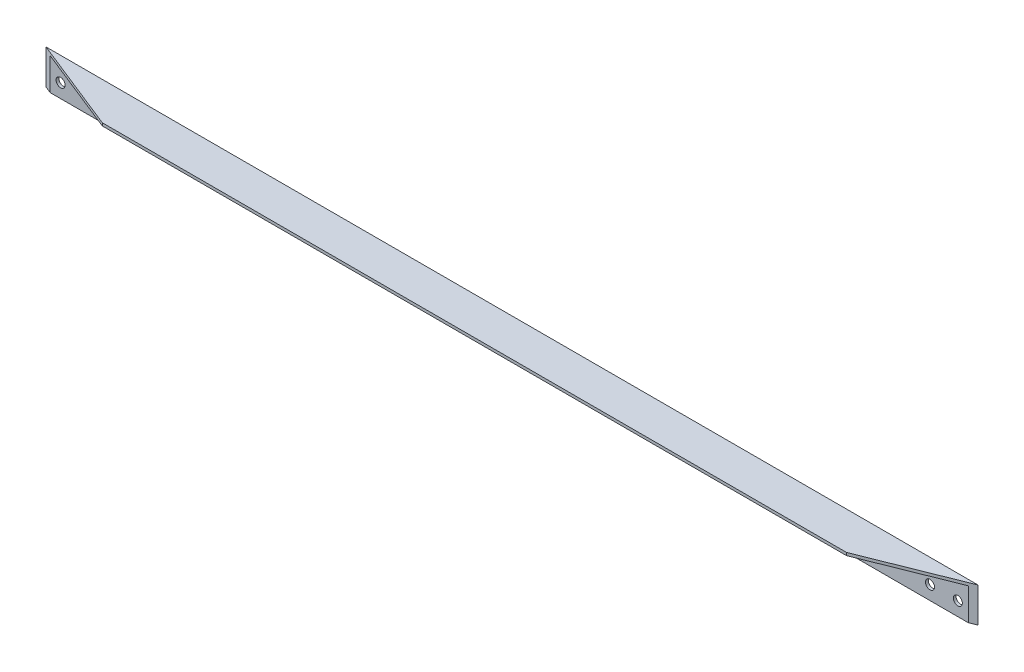
from build123d import *

# Parameters (mm, degrees)
SKETCH_1_W          = 2680
SKETCH_1_H          = 100
SKETCH_1_R          = 13
EXTRUDE_498_DEPTH   = 8
SKETCH_2_W          = 2680
SKETCH_2_H          = 8
EXTRUDE_1_DEPTH     = 100
CUT_EXTRUDE_1_DEPTH = 100


# Read off the part's stored shape, not the designer's step: 切除-拉伸1
with BuildPart() as part:
    # 草图1 → Extrude 498 (new body)
    with BuildSketch(Plane.XY):
        with Locations((0, 50)):
            Rectangle(SKETCH_1_W, SKETCH_1_H)
        with Locations((1290, 40)):
            Circle(SKETCH_1_R, mode=Mode.SUBTRACT)
        with Locations((1210, 40)):
            Circle(SKETCH_1_R, mode=Mode.SUBTRACT)
        with Locations((0, 40)):
            Circle(SKETCH_1_R, mode=Mode.SUBTRACT)
        with Locations((100, 40)):
            Circle(SKETCH_1_R, mode=Mode.SUBTRACT)
        with Locations(Location((-100, 40, 0), (0, 0, 180))):
            Circle(SKETCH_1_R, mode=Mode.SUBTRACT)
        with Locations(Location((-1290, 40, 0), (0, 0, 180))):
            Circle(SKETCH_1_R, mode=Mode.SUBTRACT)
        with Locations(Location((-1210, 40, 0), (0, 0, 180))):
            Circle(SKETCH_1_R, mode=Mode.SUBTRACT)
    extrude(amount=EXTRUDE_498_DEPTH)

    # 草图2 → 凸台-拉伸1 (add)
    with BuildSketch(Plane.XY.offset(8)):
        with Locations((0, 96)):
            Rectangle(SKETCH_2_W, SKETCH_2_H)
    extrude(amount=EXTRUDE_1_DEPTH)

    # 切除-拉伸1 outline → 切除-拉伸1 (cut)
    with BuildSketch(Plane(origin=(0, 0, 0), x_dir=(1, 0, 0), z_dir=(0, 1, 0))):
        Polygon((1340, -108), (1340, 0), (1070, -108), align=None)
        Polygon((-1340, -108), (-1070, -108), (-1340, 0), align=None)
    extrude(amount=CUT_EXTRUDE_1_DEPTH, mode=Mode.SUBTRACT)


solid = part.part
